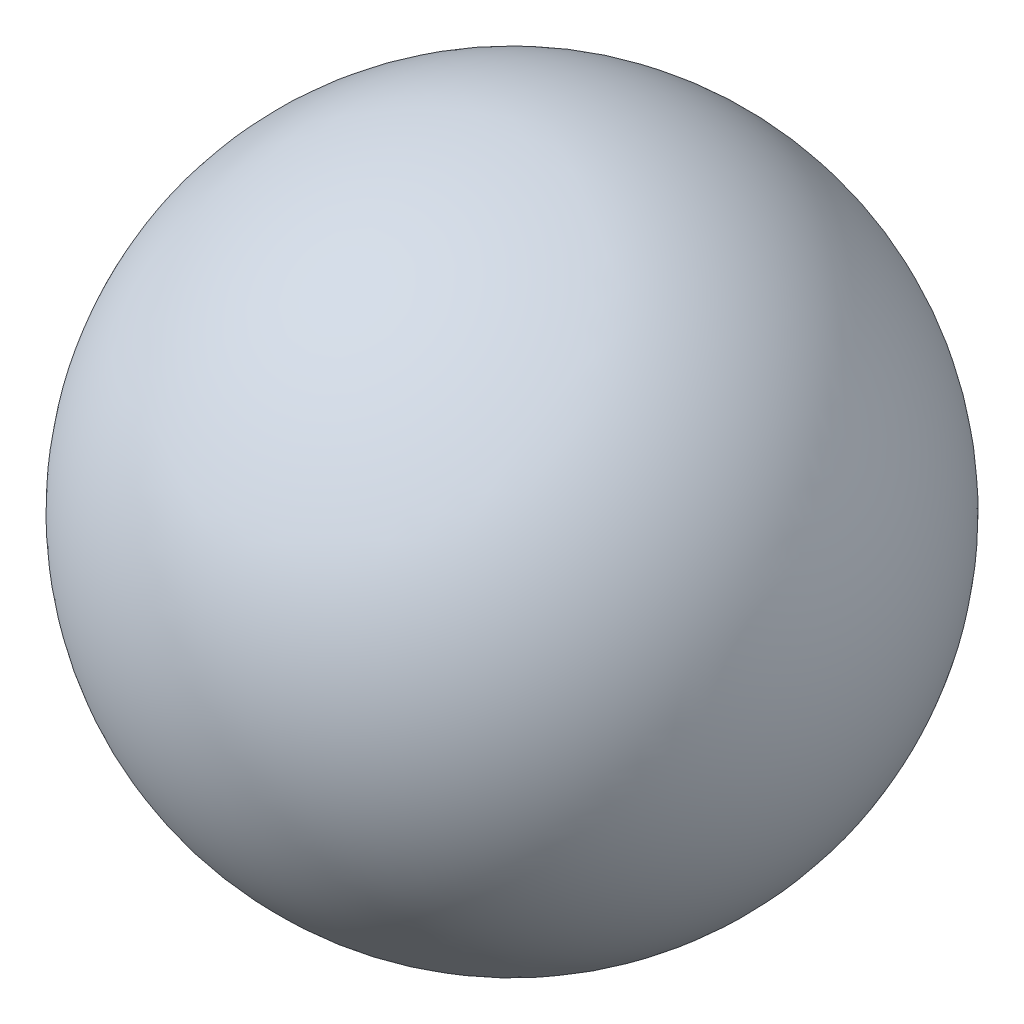
from build123d import *


with BuildPart() as part:
    # Sketch1 → Revolve1 (revolve)
    with BuildSketch(Plane(origin=(0, 0, 0), x_dir=(1, 0, 0), z_dir=(0, 1, 0))):
        with BuildLine():
            ThreePointArc((1.48, 0), (0, 1.48), (-1.48, 0))
            Line((-1.48, 0), (1.48, 0))
        make_face()
    revolve(axis=Axis((-1.48, 0, 0), (1, 0, 0)))


solid = part.part
